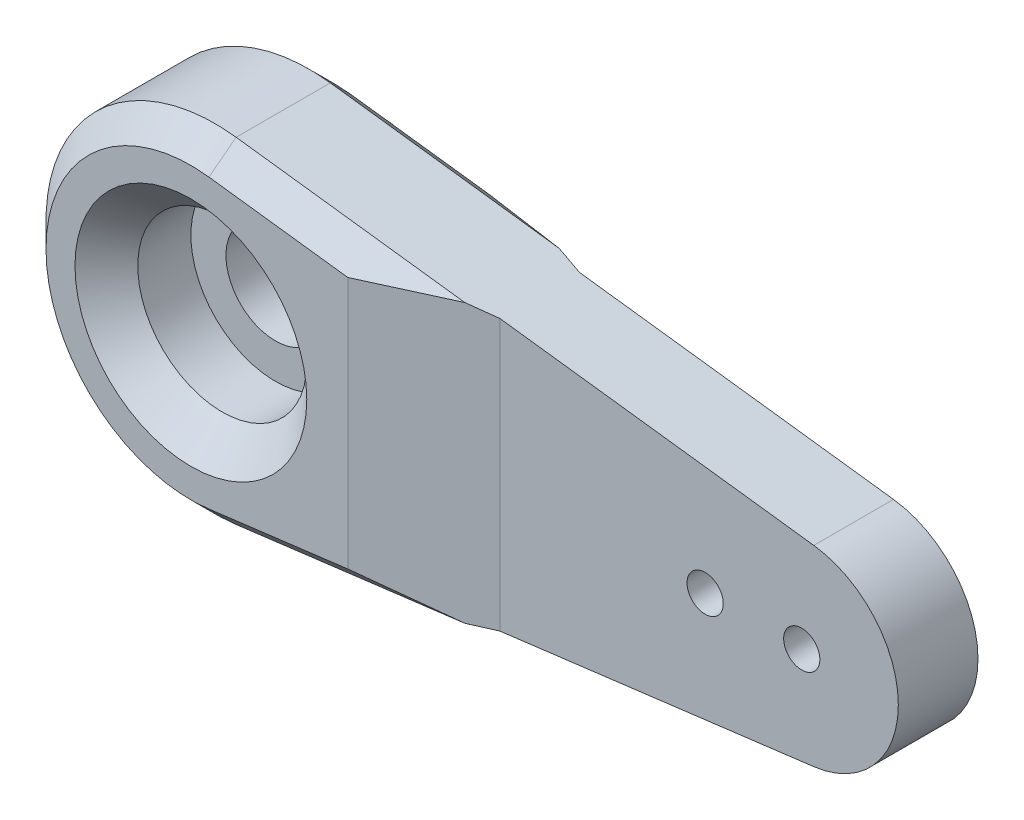
from build123d import *

# Parameters (mm, degrees)
ESQUISSE1_R             = 2.046773471
BOSS_EXTRU_1_DEPTH      = 3.3
BOSS_EXTRU_2_DEPTH      = 1.3
BOSS_EXTRU_2_DEPTH_BACK = 4.6
ESQUISSE2_R             = 2.046773471
CHANFREIN1_SIZE         = 5
CHANFREIN1_SIZE_2       = 1.3
CHANFREIN3_SIZE         = 5
CHANFREIN3_SIZE_2       = 1.3
CHANFREIN2_SIZE         = 1
ESQUISSE3_R             = 5.5
ESQUISSE3_R_2           = 2.75
BOSS_EXTRU_3_DEPTH      = 1.8
CHANFREIN4_SIZE         = 1.5
ESQUISSE4_R             = 3.5
ENL_V_MAT_EXTRU_1_DEPTH = 3.5
CHANFREIN5_SIZE         = 1.3
ESQUISSE5_R             = 0.75
ENL_V_MAT_EXTRU_2_DEPTH = 3.5


with BuildPart() as part:
    # Esquisse1 → Boss.-Extru.1 (new body)
    with BuildSketch(Plane.XY):
        with BuildLine():
            Line((0.875, 6.945097192), (24.5, 3.968626967))
            ThreePointArc((24.5, 3.968626967), (28, 0), (24.5, -3.968626967))
            Line((24.5, -3.968626967), (0.875, -6.945097192))
            ThreePointArc((0.875, -6.945097192), (-7, 0), (0.875, 6.945097192))
        make_face()
        Circle(ESQUISSE1_R, mode=Mode.SUBTRACT)
    extrude(amount=BOSS_EXTRU_1_DEPTH)

    # Esquisse2 → Boss.-Extru.2 (add, two sides: drawn at the far end of the back side and taken through both)
    with BuildSketch(Plane.XY.offset(3.3).offset(-BOSS_EXTRU_2_DEPTH_BACK)):
        with BuildLine():
            Line((0.875, 6.945097192), (6.5, 6.236413805))
            Line((6.5, 6.236413805), (6.5, -6.236413805))
            Line((6.5, -6.236413805), (0.875, -6.945097192))
            ThreePointArc((0.875, -6.945097192), (-7, 0), (0.875, 6.945097192))
        make_face()
        Circle(ESQUISSE2_R, mode=Mode.SUBTRACT)
    extrude(amount=BOSS_EXTRU_2_DEPTH + BOSS_EXTRU_2_DEPTH_BACK)

    # Chanfrein1
    # the kernel refuses this chamfer: 5, 1.3 mm, written as the material it adds along each edge
    with BuildSketch(Plane(origin=(6.5, 19.22093464, 3.3), x_dir=(0.9999530531472482, 0, -0.009689762716214913), z_dir=(0, -1, 0))) as chanfrein1_piece_1_section:
        Polygon((CHANFREIN1_SIZE * 0.999953053147, CHANFREIN1_SIZE * 0.00968976271621), (-CHANFREIN1_SIZE_2 * 0.00968976271621, CHANFREIN1_SIZE_2 * 0.999953053147), (0, 0), align=None)
    chanfrein1_piece_1 = extrude(amount=38.441869281, mode=Mode.PRIVATE)
    chanfrein1_piece_1 = split(chanfrein1_piece_1, bisect_by=Plane(origin=(8.958471047, 5.926675567, 3.684204829), z_dir=(-0.12500000000000006, -0.9921567416492215, 0)), keep=Keep.TOP, mode=Mode.PRIVATE)
    chanfrein1_piece_1 = split(chanfrein1_piece_1, bisect_by=Plane(origin=(8.958471047, -5.926675567, 3.684204829), z_dir=(-0.1249999999999999, 0.9921567416492215, 0)), keep=Keep.TOP, mode=Mode.PRIVATE)
    chanfrein1_piece_1 = split(chanfrein1_piece_1, bisect_by=Plane(origin=(8.211780112, 0, 4.6), z_dir=(0, 0, -1)), keep=Keep.TOP, mode=Mode.PRIVATE)
    add(chanfrein1_piece_1)

    # Chanfrein3
    # the kernel refuses this chamfer: 5, 1.3 mm, written as the material it adds along each edge
    with BuildSketch(Plane(origin=(6.5, 19.22093464, 0), x_dir=(0.9999530531472482, 0, 0.009689762716214958), z_dir=(0, -1, 0))) as chanfrein3_piece_1_section:
        Polygon((CHANFREIN3_SIZE * 0.999953053147, -CHANFREIN3_SIZE * 0.00968976271621), (-CHANFREIN3_SIZE_2 * 0.00968976271621, -CHANFREIN3_SIZE_2 * 0.999953053147), (0, 0), align=None)
    chanfrein3_piece_1 = extrude(amount=38.441869281, mode=Mode.PRIVATE)
    chanfrein3_piece_1 = split(chanfrein3_piece_1, bisect_by=Plane(origin=(8.958471047, 5.926675567, -0.384204829), z_dir=(-0.1250000000000275, -0.9921567416492181, 0)), keep=Keep.TOP, mode=Mode.PRIVATE)
    chanfrein3_piece_1 = split(chanfrein3_piece_1, bisect_by=Plane(origin=(8.958471047, -5.926675567, -0.384204829), z_dir=(-0.1250000000000275, 0.9921567416492181, 0)), keep=Keep.TOP, mode=Mode.PRIVATE)
    chanfrein3_piece_1 = split(chanfrein3_piece_1, bisect_by=Plane(origin=(8.211780112, 0, -1.3), z_dir=(0, 0, 1)), keep=Keep.TOP, mode=Mode.PRIVATE)
    add(chanfrein3_piece_1)

    # Chanfrein2
    chanfrein2_edges = [part.edges().sort_by_distance(p)[0] for p in [
        (-7, 0, -1.3),
        (3.6875, 6.590755498, -1.3),
        (3.6875, -6.590755498, -1.3),
        (-7, 0, 4.6),
        (3.6875, -6.590755498, 4.6),
        (3.6875, 6.590755498, 4.6),
    ]]
    chamfer(chanfrein2_edges, length=CHANFREIN2_SIZE)

    # Esquisse3 → Boss.-Extru.3 (add)
    with BuildSketch(Plane(origin=(0, 0, -1.3), x_dir=(-1, 0, 0), z_dir=(0, 0, -1))):
        with Locations(Location((0, 0, 0), (0, 0, 180))):
            Circle(ESQUISSE3_R)
        Circle(ESQUISSE3_R_2, mode=Mode.SUBTRACT)
    extrude(amount=BOSS_EXTRU_3_DEPTH)

    # Chanfrein4
    chanfrein4_edges = [part.edges().sort_by_distance(p)[0] for p in [
        (-5.5, 0, -3.1),
    ]]
    chamfer(chanfrein4_edges, length=CHANFREIN4_SIZE)

    # Esquisse4 → Enlèv. mat.-Extru.1 (cut)
    with BuildSketch(Plane.XY.offset(4.6)):
        Circle(ESQUISSE4_R)
    extrude(amount=-ENL_V_MAT_EXTRU_1_DEPTH, mode=Mode.SUBTRACT)

    # Chanfrein5
    chanfrein5_edges = [part.edges().sort_by_distance(p)[0] for p in [
        (-3.5, 0, 4.6),
    ]]
    chamfer(chanfrein5_edges, length=CHANFREIN5_SIZE)

    # Esquisse5 → Enlèv. mat.-Extru.2 (cut)
    with BuildSketch(Plane.XY.offset(3.3)):
        with Locations((24, 0)):
            Circle(ESQUISSE5_R)
        with Locations((20, 0)):
            Circle(ESQUISSE5_R)
    extrude(amount=-ENL_V_MAT_EXTRU_2_DEPTH, mode=Mode.SUBTRACT)


solid = part.part
